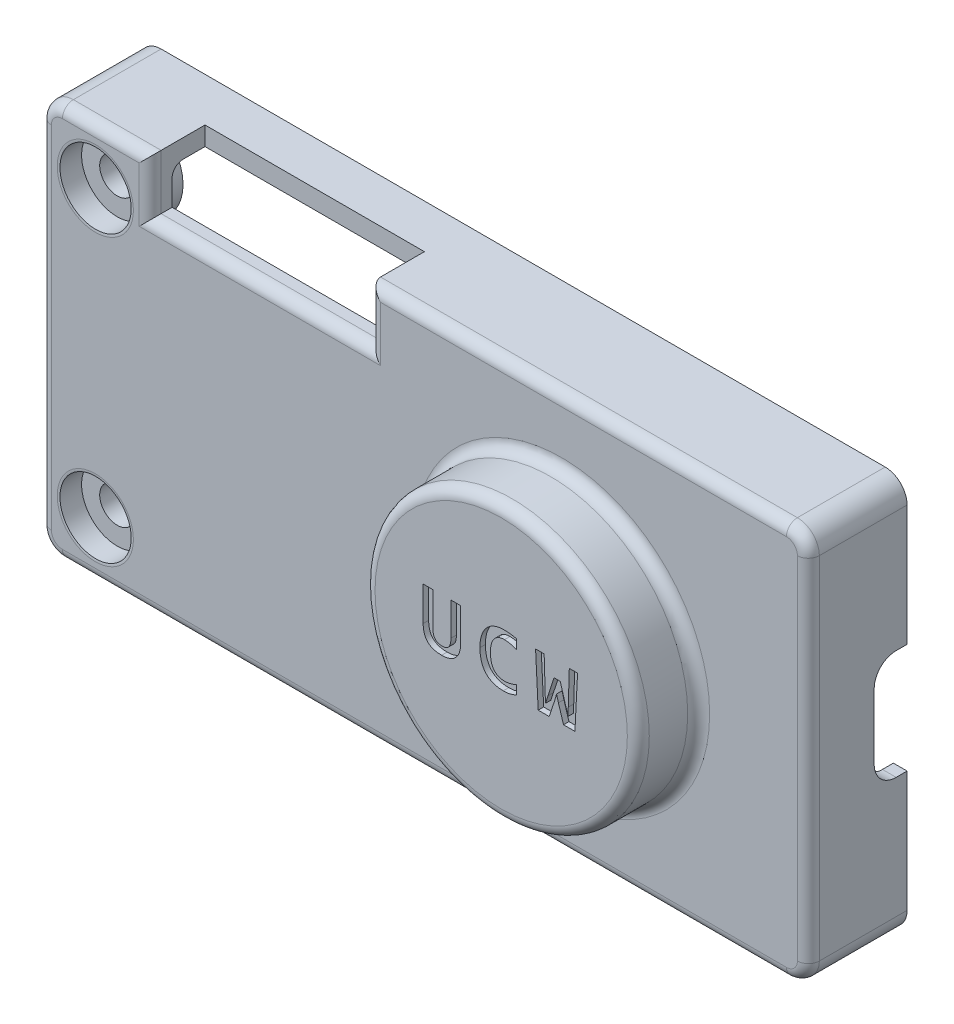
from build123d import *

# Parameters (mm, degrees)
CROQUIS1_W                                  = 70
CROQUIS1_H                                  = 36
SALIENTE_EXTRUIR1_DEPTH                     = 2
CROQUIS2_R                                  = 12.5
SALIENTE_EXTRUIR2_DEPTH                     = 5.5
CROQUIS3_W                                  = 70
CROQUIS3_H                                  = 36
CROQUIS3_W_2                                = 66.5
CROQUIS3_H_2                                = 32.5
SALIENTE_EXTRUIR3_DEPTH                     = 5
CROQUIS4_R                                  = 11
CORTAR_EXTRUIR1_DEPTH                       = 6
SALIENTE_EXTRUIR4_DEPTH                     = 2
CROQUIS14_W                                 = 70
CROQUIS14_H                                 = 36
CROQUIS14_W_2                               = 66.5
CROQUIS14_H_2                               = 32.5
SALIENTE_EXTRUIR5_DEPTH                     = 2
CORTAR_EXTRUIR7_DEPTH                       = 2
CROQUIS11_W                                 = 3
CROQUIS11_H                                 = 10
CORTAR_EXTRUIR4_DEPTH                       = 10
CROQUIS16_W                                 = 20
CROQUIS16_H                                 = 5
CORTAR_EXTRUIR8_DEPTH                       = 5
CORTAR_EXTRUIR9_DEPTH                       = 1.5
REFRENTADO_PARA_TORNILLO_CON_CABEZA_2_COUNT = 2
REFRENTADO_PARA_TORNILLO_CON_CABEZA_2_PITCH = 26
REDONDEO1_R                                 = 1
REDONDEO2_R                                 = 1
REDONDEO3_R                                 = 2
CORTAR_EXTRUIR6_DEPTH                       = 0.5


with BuildPart() as part:
    # Croquis1 → Saliente-Extruir1 (new body)
    with BuildSketch(Plane.XY):
        with Locations((15.33747406, 26.070037414)):
            Rectangle(CROQUIS1_W, CROQUIS1_H)
    extrude(amount=SALIENTE_EXTRUIR1_DEPTH)

    # Croquis2 → Saliente-Extruir2 (add)
    with BuildSketch(Plane.XY.offset(2)):
        with Locations((27.83747406, 25.570037414)):
            Circle(CROQUIS2_R)
    extrude(amount=SALIENTE_EXTRUIR2_DEPTH)

    # Croquis3 → Saliente-Extruir3 (add)
    with BuildSketch(Plane(origin=(0, 0, 0), x_dir=(-1, 0, 0), z_dir=(0, 0, -1))):
        with Locations((-15.33747406, 26.070037414)):
            Rectangle(CROQUIS3_W, CROQUIS3_H)
        with Locations((-15.33747406, 26.113242754)):
            Rectangle(CROQUIS3_W_2, CROQUIS3_H_2, mode=Mode.SUBTRACT)
    extrude(amount=SALIENTE_EXTRUIR3_DEPTH)

    # Croquis4 → Cortar-Extruir1 (cut)
    with BuildSketch(Plane(origin=(0, 0, 0), x_dir=(-1, 0, 0), z_dir=(0, 0, -1))):
        with Locations((-27.83747406, 25.570037414)):
            Circle(CROQUIS4_R)
    extrude(amount=-CORTAR_EXTRUIR1_DEPTH, mode=Mode.SUBTRACT)

    # Croquis5 → Saliente-Extruir4 (add)
    with BuildSketch(Plane(origin=(0, 0, 0), x_dir=(-1, 0, 0), z_dir=(0, 0, -1))):
        with BuildLine():
            Line((-48.58747406, 15.776832074), (-48.58747406, 9.776832074))
            Line((-48.58747406, 9.776832074), (-45.58747406, 9.776832074))
            Line((-45.58747406, 9.776832074), (-42.58747406, 9.776832074))
            ThreePointArc((-42.58747406, 9.776832074), (-42.58747406, 15.776832074), (-48.58747406, 15.776832074))
        make_face()
        with BuildLine():
            Line((-45.58747406, 42.363242754), (-48.58747406, 42.363242754))
            Line((-48.58747406, 42.363242754), (-48.58747406, 36.363242754))
            ThreePointArc((-48.58747406, 36.363242754), (-42.58747406, 36.363242754), (-42.58747406, 42.363242754))
            Line((-42.58747406, 42.363242754), (-45.58747406, 42.363242754))
        make_face()
        with BuildLine():
            Line((14.91252594, 9.776832074), (17.91252594, 9.776832074))
            Line((17.91252594, 9.776832074), (17.91252594, 15.776832074))
            ThreePointArc((17.91252594, 15.776832074), (11.91252594, 15.776832074), (11.91252594, 9.776832074))
            Line((11.91252594, 9.776832074), (14.91252594, 9.776832074))
        make_face()
        with BuildLine():
            Line((17.91252594, 36.363242754), (17.91252594, 42.363242754))
            Line((17.91252594, 42.363242754), (14.91252594, 42.363242754))
            Line((14.91252594, 42.363242754), (11.91252594, 42.363242754))
            ThreePointArc((11.91252594, 42.363242754), (11.91252594, 36.363242754), (17.91252594, 36.363242754))
        make_face()
    extrude(amount=SALIENTE_EXTRUIR4_DEPTH)

    # Croquis14 → Saliente-Extruir5 (add)
    with BuildSketch(Plane(origin=(0, 0, -5), x_dir=(-1, 0, 0), z_dir=(0, 0, -1))):
        with Locations((-15.33747406, 26.070037414)):
            Rectangle(CROQUIS14_W, CROQUIS14_H)
        with Locations((-15.33747406, 26.113242754)):
            Rectangle(CROQUIS14_W_2, CROQUIS14_H_2, mode=Mode.SUBTRACT)
    extrude(amount=SALIENTE_EXTRUIR5_DEPTH)

    # Croquis15 → Cortar-Extruir7 (cut)
    with BuildSketch(Plane.XZ.offset(-8.070037414)):
        Polygon((9.83747406, -3), (9.83747406, -6), (9.83747406, -7), (40.83747406, -7), (40.83747406, -3), align=None)
    extrude(amount=-CORTAR_EXTRUIR7_DEPTH, mode=Mode.SUBTRACT)

    # Croquis11 → Cortar-Extruir4 (cut)
    with BuildSketch(Plane(origin=(50.33747406, 0, 0), x_dir=(0, 0, -1), z_dir=(1, 0, 0))):
        with Locations((5.5, 26.070037414)):
            Rectangle(CROQUIS11_W, CROQUIS11_H)
    extrude(amount=-CORTAR_EXTRUIR4_DEPTH, mode=Mode.SUBTRACT)

    # Croquis16 → Cortar-Extruir8 (cut)
    with BuildSketch(Plane(origin=(0, 44.070037414, 0), x_dir=(1, 0, 0), z_dir=(0, 1, 0))):
        with Locations((0.33747406, 0.5)):
            Rectangle(CROQUIS16_W, CROQUIS16_H)
    extrude(amount=-CORTAR_EXTRUIR8_DEPTH, mode=Mode.SUBTRACT)

    # Croquis17 → Cortar-Extruir9 (cut)
    with BuildSketch(Plane(origin=(0, 0, -7), x_dir=(-1, 0, 0), z_dir=(0, 0, -1))):
        Polygon((-48.58747406, 31.070037414), (-48.58747406, 42.363242754), (-48.58747406, 42.863242754), (-49.08747406, 42.863242754), (-49.08747406, 31.070037414), align=None)
        Polygon((-48.58747406, 9.863242754), (-48.58747406, 31.070037414), (-49.08747406, 31.070037414), (-49.08747406, 9.363242754), (-9.83747406, 9.363242754), (-9.83747406, 9.863242754), align=None)
        Polygon((18.41252594, 9.863242754), (17.91252594, 9.863242754), (-9.83747406, 9.863242754), (-9.83747406, 9.363242754), (18.41252594, 9.363242754), align=None)
        Polygon((-48.58747406, 42.863242754), (-48.58747406, 42.363242754), (17.91252594, 42.363242754), (17.91252594, 9.863242754), (18.41252594, 9.863242754), (18.41252594, 42.863242754), align=None)
    extrude(amount=-CORTAR_EXTRUIR9_DEPTH, mode=Mode.SUBTRACT)

    # Croquis8 → Refrentado para tornillo con cabeza plana de M31 (revolve, cut)
    with BuildSketch(Plane(origin=(-14.66252594, 39.070037414, 2), x_dir=(0, -1, 0), z_dir=(1, 0, 0))):
        Polygon((0, 0), (0, 9), (1.6, 9), (1.6, 2), (3.25, 2), (3.25, 0.025), (3.275, 0), align=None)
    refrentado_para_tornillo_con_cabeza_plan = revolve(axis=Axis((-14.66252594, 39.070037414, 8.35), (0, 0, -1)), mode=Mode.SUBTRACT)

    # Refrentado para tornillo con cabeza  2: Refrentado para tornillo con cabeza plana de M31 ×2
    with Locations(*[(0, -i * REFRENTADO_PARA_TORNILLO_CON_CABEZA_2_PITCH, 0) for i in range(1, REFRENTADO_PARA_TORNILLO_CON_CABEZA_2_COUNT)]):
        add(refrentado_para_tornillo_con_cabeza_plan, mode=Mode.SUBTRACT)

    # Redondeo1
    redondeo1_edges = [part.edges().sort_by_distance(p)[0] for p in [
        (-10.78752594, 42.363242754, 0),
        (38.83747406, 25.570037414, 6),
        (38.83747406, 25.570037414, 0),
        (26.46247406, 42.363242754, 0),
        (42.58747406, 36.363242754, 0),
        (48.58747406, 26.070037414, 0),
        (42.630381187, 15.81913412, 0),
        (-11.91252594, 36.363242754, 0),
        (-17.91252594, 26.070037414, 0),
        (15.33747406, 9.863242754, 0),
        (-11.955433067, 15.81913412, 0),
    ]]
    fillet(redondeo1_edges, radius=REDONDEO1_R)

    # Redondeo2
    # the kernel refuses this fillet: 1 mm, written as the material it adds along each edge
    with BuildSketch(Plane(origin=(27.83747406, 25.570037414, 2), x_dir=(1, 0, 0), z_dir=(0, -1, 0))) as redondeo2_piece_1:
        with BuildLine():
            CenterArc((12.5 + REDONDEO2_R, REDONDEO2_R), REDONDEO2_R, 180, 90)
            Line((12.5, REDONDEO2_R), (12.5, 0))
            Line((12.5, 0), (12.5 + REDONDEO2_R, 0))
        make_face()
    revolve(axis=Axis((27.83747406, 25.570037414, 2), (0, 0, 1)))
    # the kernel refuses this fillet: 1 mm, written as the material it takes off along each edge
    with BuildSketch(Plane(origin=(50.33747406, 46.570037414, 2), x_dir=(-1, 0, 0), z_dir=(0, -1, 0)), Plane(origin=(-19.66252594, 5.570037414, 2), x_dir=(1, 0, 0), z_dir=(0, 1, 0))) as redondeo2_2_piece_1:
        with BuildLine():
            CenterArc((REDONDEO2_R, REDONDEO2_R), REDONDEO2_R, 180, 90)
            Line((0, REDONDEO2_R), (0, 0))
            Line((0, 0), (REDONDEO2_R, 0))
        make_face()
    extrude(amount=41, mode=Mode.SUBTRACT)
    with BuildSketch(Plane(origin=(27.83747406, 25.570037414, 7.5), x_dir=(1, 0, 0), z_dir=(0, -1, 0))) as redondeo2_2_piece_2:
        with BuildLine():
            CenterArc((12.5 - REDONDEO2_R, -REDONDEO2_R), REDONDEO2_R, 0, 90)
            Line((12.5 - REDONDEO2_R, 0), (12.5, 0))
            Line((12.5, 0), (12.5, -REDONDEO2_R))
        make_face()
    revolve(axis=Axis((27.83747406, 25.570037414, 7.5), (0, 0, 1)), mode=Mode.SUBTRACT)
    with BuildSketch(Plane(origin=(-22.16252594, 44.070037414, 2), x_dir=(0, 0, -1), z_dir=(1, 0, 0))) as redondeo2_2_piece_3:
        with BuildLine():
            CenterArc((REDONDEO2_R, -REDONDEO2_R), REDONDEO2_R, 90, 90)
            Line((0, -REDONDEO2_R), (0, 0))
            Line((0, 0), (REDONDEO2_R, 0))
        make_face()
    extrude(amount=15, mode=Mode.SUBTRACT)
    with BuildSketch(Plane(origin=(-9.66252594, 46.570037414, 2), x_dir=(-1, 0, 0), z_dir=(0, -1, 0)), Plane(origin=(10.33747406, 46.570037414, 2), x_dir=(0, 0, -1), z_dir=(0, -1, 0))) as redondeo2_2_piece_4:
        with BuildLine():
            CenterArc((REDONDEO2_R, REDONDEO2_R), REDONDEO2_R, 180, 90)
            Line((0, REDONDEO2_R), (0, 0))
            Line((0, 0), (REDONDEO2_R, 0))
        make_face()
    extrude(amount=7.5, mode=Mode.SUBTRACT)
    with BuildSketch(Plane(origin=(-9.66252594, 39.070037414, 2), x_dir=(0, 0, -1), z_dir=(1, 0, 0))) as redondeo2_2_piece_5:
        with BuildLine():
            CenterArc((REDONDEO2_R, -REDONDEO2_R), REDONDEO2_R, 90, 90)
            Line((0, -REDONDEO2_R), (0, 0))
            Line((0, 0), (REDONDEO2_R, 0))
        make_face()
    extrude(amount=20, mode=Mode.SUBTRACT)
    with BuildSketch(Plane(origin=(7.83747406, 44.070037414, 2), x_dir=(0, 0, -1), z_dir=(1, 0, 0))) as redondeo2_2_piece_6:
        with BuildLine():
            CenterArc((REDONDEO2_R, -REDONDEO2_R), REDONDEO2_R, 90, 90)
            Line((0, -REDONDEO2_R), (0, 0))
            Line((0, 0), (REDONDEO2_R, 0))
        make_face()
    extrude(amount=45, mode=Mode.SUBTRACT)
    with BuildSketch(Plane(origin=(-14.66252594, 13.070037414, 2), x_dir=(0, -1, 0), z_dir=(1, 0, 0))) as redondeo2_2_piece_7:
        with BuildLine():
            CenterArc((3.47220486, 1), REDONDEO2_R, 257.161431859, 12.838568141)
            Line((3.25, 0.025), (3.275, 0))
            Line((3.275, 0), (3.47220486, 0))
        make_face()
    revolve(axis=Axis((-14.66252594, 13.070037414, 2), (0, 0, -1)), mode=Mode.SUBTRACT)
    with BuildSketch(Plane(origin=(-14.66252594, 39.070037414, 2), x_dir=(0, -1, 0), z_dir=(1, 0, 0))) as redondeo2_2_piece_8:
        with BuildLine():
            CenterArc((3.47220486, 1), REDONDEO2_R, 257.161431859, 12.838568141)
            Line((3.25, 0.025), (3.275, 0))
            Line((3.275, 0), (3.47220486, 0))
        make_face()
    revolve(axis=Axis((-14.66252594, 39.070037414, 2), (0, 0, -1)), mode=Mode.SUBTRACT)
    with BuildSketch(Plane(origin=(52.83747406, 8.070037414, 2), x_dir=(0, 1, 0), z_dir=(-1, 0, 0))) as redondeo2_2_piece_9:
        with BuildLine():
            CenterArc((REDONDEO2_R, REDONDEO2_R), REDONDEO2_R, 180, 90)
            Line((0, REDONDEO2_R), (0, 0))
            Line((0, 0), (REDONDEO2_R, 0))
        make_face()
    extrude(amount=75, mode=Mode.SUBTRACT)
    with BuildSketch(Plane(origin=(-12.16252594, 39.070037414, 2), x_dir=(0, 0, -1), z_dir=(1, 0, 0))) as redondeo2_2_piece_10a_section:
        with BuildLine():
            CenterArc((REDONDEO2_R, -REDONDEO2_R), REDONDEO2_R, 90, 90)
            Line((0, -REDONDEO2_R), (0, 0))
            Line((0, 0), (REDONDEO2_R, 0))
        make_face()
    redondeo2_2_piece_10a = extrude(amount=22.5, mode=Mode.PRIVATE)
    redondeo2_2_piece_10a = split(redondeo2_2_piece_10a, bisect_by=Plane(origin=(-9.66252594, 39.070037414, 2), z_dir=(-1, 0, 0)), keep=Keep.TOP, mode=Mode.PRIVATE)
    with BuildSketch(Plane(origin=(-9.66252594, 46.570037414, 2), x_dir=(-1, 0, 0), z_dir=(0, -1, 0))) as redondeo2_2_piece_10b_section:
        with BuildLine():
            CenterArc((REDONDEO2_R, REDONDEO2_R), REDONDEO2_R, 180, 90)
            Line((0, REDONDEO2_R), (0, 0))
            Line((0, 0), (REDONDEO2_R, 0))
        make_face()
    redondeo2_2_piece_10b = extrude(amount=10, mode=Mode.PRIVATE)
    redondeo2_2_piece_10b = split(redondeo2_2_piece_10b, bisect_by=Plane(origin=(-9.66252594, 39.070037414, 2), z_dir=(0, -1, 0)), keep=Keep.TOP, mode=Mode.PRIVATE)
    redondeo2_2_piece_10 = redondeo2_2_piece_10a & redondeo2_2_piece_10b
    add(redondeo2_2_piece_10, mode=Mode.SUBTRACT)
    with BuildSketch(Plane(origin=(10.33747406, 46.570037414, 2), x_dir=(0, 0, -1), z_dir=(0, -1, 0))) as redondeo2_2_piece_11a_section:
        with BuildLine():
            CenterArc((REDONDEO2_R, REDONDEO2_R), REDONDEO2_R, 180, 90)
            Line((0, REDONDEO2_R), (0, 0))
            Line((0, 0), (REDONDEO2_R, 0))
        make_face()
    redondeo2_2_piece_11a = extrude(amount=10, mode=Mode.PRIVATE)
    redondeo2_2_piece_11a = split(redondeo2_2_piece_11a, bisect_by=Plane(origin=(10.33747406, 39.070037414, 2), z_dir=(0, -1, 0)), keep=Keep.TOP, mode=Mode.PRIVATE)
    with BuildSketch(Plane(origin=(-9.66252594, 39.070037414, 2), x_dir=(0, 0, -1), z_dir=(1, 0, 0))) as redondeo2_2_piece_11b_section:
        with BuildLine():
            CenterArc((REDONDEO2_R, -REDONDEO2_R), REDONDEO2_R, 90, 90)
            Line((0, -REDONDEO2_R), (0, 0))
            Line((0, 0), (REDONDEO2_R, 0))
        make_face()
    redondeo2_2_piece_11b = extrude(amount=22.5, mode=Mode.PRIVATE)
    redondeo2_2_piece_11b = split(redondeo2_2_piece_11b, bisect_by=Plane(origin=(10.33747406, 39.070037414, 2), z_dir=(1, 0, 0)), keep=Keep.TOP, mode=Mode.PRIVATE)
    redondeo2_2_piece_11 = redondeo2_2_piece_11a & redondeo2_2_piece_11b
    add(redondeo2_2_piece_11, mode=Mode.SUBTRACT)

    # Redondeo3
    # the kernel refuses this fillet: 2 mm, written as the material it adds along each edge
    with BuildSketch(Plane(origin=(48.58747406, 9.863242754, -5.5), x_dir=(-1, 0, 0), z_dir=(0, 0, 1)), Plane(origin=(-17.91252594, 9.863242754, -2), x_dir=(1, 0, 0), z_dir=(0, 0, -1)), Plane(origin=(-17.91252594, 42.363242754, -5.5), x_dir=(1, 0, 0), z_dir=(0, 0, 1))) as redondeo3_piece_1:
        with BuildLine():
            CenterArc((REDONDEO3_R, -REDONDEO3_R), REDONDEO3_R, 90, 90)
            Line((0, -REDONDEO3_R), (0, 0))
            Line((0, 0), (REDONDEO3_R, 0))
        make_face()
    extrude(amount=3.5)
    with BuildSketch(Plane(origin=(50.33747406, 21.070037414, -4), x_dir=(0, 1, 0), z_dir=(-1, 0, 0))) as redondeo3_piece_2_section:
        with BuildLine():
            CenterArc((REDONDEO3_R, REDONDEO3_R), REDONDEO3_R, 180, 90)
            Line((0, REDONDEO3_R), (0, 0))
            Line((0, 0), (REDONDEO3_R, 0))
        make_face()
    redondeo3_piece_2 = extrude(amount=1.75, mode=Mode.PRIVATE)
    redondeo3_piece_2 = split(redondeo3_piece_2, bisect_by=Plane(origin=(50.33747406, 21.070037414, -5.5), z_dir=(0, 0, 1)), keep=Keep.TOP, mode=Mode.PRIVATE)
    add(redondeo3_piece_2)
    with BuildSketch(Plane(origin=(50.33747406, 21.070037414, -4), x_dir=(0, 1, 0), z_dir=(-1, 0, 0))) as redondeo3_piece_3_section:
        with BuildLine():
            CenterArc((REDONDEO3_R, REDONDEO3_R), REDONDEO3_R, 180, 90)
            Line((0, REDONDEO3_R), (0, 0))
            Line((0, 0), (REDONDEO3_R, 0))
        make_face()
    redondeo3_piece_3 = extrude(amount=6.75, mode=Mode.PRIVATE)
    redondeo3_piece_3 = split(redondeo3_piece_3, bisect_by=Plane(origin=(49.08747406, 21.070037414, -4), z_dir=(1, 0, 0)), keep=Keep.TOP, mode=Mode.PRIVATE)
    add(redondeo3_piece_3)
    with BuildSketch(Plane(origin=(50.33747406, 31.070037414, -4), x_dir=(0, -1, 0), z_dir=(-1, 0, 0))) as redondeo3_piece_4_section:
        with BuildLine():
            CenterArc((REDONDEO3_R, -REDONDEO3_R), REDONDEO3_R, 90, 90)
            Line((0, -REDONDEO3_R), (0, 0))
            Line((0, 0), (REDONDEO3_R, 0))
        make_face()
    redondeo3_piece_4 = extrude(amount=1.75, mode=Mode.PRIVATE)
    redondeo3_piece_4 = split(redondeo3_piece_4, bisect_by=Plane(origin=(50.33747406, 31.070037414, -5.5), z_dir=(0, 0, 1)), keep=Keep.TOP, mode=Mode.PRIVATE)
    add(redondeo3_piece_4)
    with BuildSketch(Plane(origin=(50.33747406, 31.070037414, -4), x_dir=(0, -1, 0), z_dir=(-1, 0, 0))) as redondeo3_piece_5_section:
        with BuildLine():
            CenterArc((REDONDEO3_R, -REDONDEO3_R), REDONDEO3_R, 90, 90)
            Line((0, -REDONDEO3_R), (0, 0))
            Line((0, 0), (REDONDEO3_R, 0))
        make_face()
    redondeo3_piece_5 = extrude(amount=6.75, mode=Mode.PRIVATE)
    redondeo3_piece_5 = split(redondeo3_piece_5, bisect_by=Plane(origin=(49.08747406, 31.070037414, -4), z_dir=(1, 0, 0)), keep=Keep.TOP, mode=Mode.PRIVATE)
    add(redondeo3_piece_5)
    with BuildSketch(Plane(origin=(48.58747406, 42.363242754, -5.5), x_dir=(-1, 0, 0), z_dir=(0, 0, 1))) as redondeo3_piece_6:
        with BuildLine():
            CenterArc((REDONDEO3_R, REDONDEO3_R), REDONDEO3_R, 180, 90)
            Line((0, REDONDEO3_R), (0, 0))
            Line((0, 0), (REDONDEO3_R, 0))
        make_face()
    extrude(amount=3.5)
    with BuildSketch(Plane(origin=(49.08747406, 9.363242754, -7), x_dir=(0, 1, 0), z_dir=(0, 0, 1))) as redondeo3_piece_7:
        with BuildLine():
            CenterArc((REDONDEO3_R, REDONDEO3_R), REDONDEO3_R, 180, 90)
            Line((0, REDONDEO3_R), (0, 0))
            Line((0, 0), (REDONDEO3_R, 0))
        make_face()
    extrude(amount=6.5)
    with BuildSketch(Plane(origin=(-18.41252594, 9.363242754, -7), x_dir=(0, 1, 0), z_dir=(0, 0, 1)), Plane(origin=(-18.41252594, 42.863242754, -7), x_dir=(1, 0, 0), z_dir=(0, 0, 1)), Plane(origin=(49.08747406, 42.863242754, -7), x_dir=(0, -1, 0), z_dir=(0, 0, 1))) as redondeo3_piece_8:
        with BuildLine():
            CenterArc((REDONDEO3_R, -REDONDEO3_R), REDONDEO3_R, 90, 90)
            Line((0, -REDONDEO3_R), (0, 0))
            Line((0, 0), (REDONDEO3_R, 0))
        make_face()
    extrude(amount=6.5)
    # the kernel refuses this fillet: 2 mm, written as the material it takes off along each edge
    with BuildSketch(Plane(origin=(48.33747406, 10.070037414, 2), x_dir=(0, -1, 0), z_dir=(-1, 0, 0))) as redondeo3_2_piece_1:
        with BuildLine():
            CenterArc((1, -1), 1, 0, 90)
            Line((2, -1), (2, 0))
            Line((2, 0), (1, 0))
        make_face()
    revolve(axis=Axis((48.33747406, 10.070037414, 2), (0, 0, 1)), revolution_arc=90, mode=Mode.SUBTRACT)
    with BuildSketch(Plane(origin=(-17.66252594, 10.070037414, 2), x_dir=(-1, 0, 0), z_dir=(0, 1, 0))) as redondeo3_2_piece_2:
        with BuildLine():
            CenterArc((1, -1), 1, 0, 90)
            Line((2, -1), (2, 0))
            Line((2, 0), (1, 0))
        make_face()
    revolve(axis=Axis((-17.66252594, 10.070037414, 2), (0, 0, 1)), revolution_arc=90, mode=Mode.SUBTRACT)
    with BuildSketch(Plane(origin=(48.33747406, 42.070037414, 2), x_dir=(1, 0, 0), z_dir=(0, -1, 0))) as redondeo3_2_piece_3:
        with BuildLine():
            CenterArc((1, -1), 1, 0, 90)
            Line((2, -1), (2, 0))
            Line((2, 0), (1, 0))
        make_face()
    revolve(axis=Axis((48.33747406, 42.070037414, 2), (0, 0, 1)), revolution_arc=90, mode=Mode.SUBTRACT)
    with BuildSketch(Plane(origin=(-17.66252594, 42.070037414, 2), x_dir=(0, 1, 0), z_dir=(1, 0, 0))) as redondeo3_2_piece_4:
        with BuildLine():
            CenterArc((1, -1), 1, 0, 90)
            Line((2, -1), (2, 0))
            Line((2, 0), (1, 0))
        make_face()
    revolve(axis=Axis((-17.66252594, 42.070037414, 2), (0, 0, 1)), revolution_arc=90, mode=Mode.SUBTRACT)
    with BuildSketch(Plane(origin=(50.33747406, 44.070037414, 2), x_dir=(-1, 0, 0), z_dir=(0, 0, -1))) as redondeo3_2_piece_5:
        with BuildLine():
            CenterArc((REDONDEO3_R, -REDONDEO3_R), REDONDEO3_R, 90, 90)
            Line((0, -REDONDEO3_R), (0, 0))
            Line((0, 0), (REDONDEO3_R, 0))
        make_face()
    extrude(amount=14, mode=Mode.SUBTRACT)
    with BuildSketch(Plane(origin=(-19.66252594, 44.070037414, -12), x_dir=(0, -1, 0), z_dir=(0, 0, 1)), Plane(origin=(-19.66252594, 8.070037414, -12), x_dir=(1, 0, 0), z_dir=(0, 0, 1)), Plane(origin=(50.33747406, 8.070037414, 2), x_dir=(-1, 0, 0), z_dir=(0, 0, -1))) as redondeo3_2_piece_6:
        with BuildLine():
            CenterArc((REDONDEO3_R, REDONDEO3_R), REDONDEO3_R, 180, 90)
            Line((0, REDONDEO3_R), (0, 0))
            Line((0, 0), (REDONDEO3_R, 0))
        make_face()
    extrude(amount=14, mode=Mode.SUBTRACT)

    # Croquis13 → Cortar-Extruir6 (cut)
    with BuildSketch(Plane.XY.offset(7.5)):
        with BuildLine():
            add(Edge.make_bspline(
                [(24.142745535, 25.305330145), (24.141372061, 25.232655617), (24.13870565, 25.09156801), (24.116339379, 24.886383471), (24.077790148, 24.695005223), (24.026106104, 24.517019026), (23.959376953, 24.353734768), (23.880508947, 24.203877078), (23.786895331, 24.068737645), (23.681080565, 23.946923954), (23.560961106, 23.841065109), (23.430444883, 23.746849913), (23.285551565, 23.669239838), (23.129833472, 23.603790229), (22.962419235, 23.55422377), (22.785643149, 23.517739536), (22.598685239, 23.496301169), (22.470774243, 23.493444387), (22.405218882, 23.491980264)],
                knots=[0, 0, 0, 0, 1.219997119, 2.368456715, 3.459737151, 4.494217563, 5.475369761, 6.416549746, 7.331712276, 8.229634853, 9.11860117, 10.014193365, 10.926227794, 11.871951459, 12.84573959, 13.852641022, 14.899462143, 16, 16, 16, 16], degree=3))
            add(Edge.make_bspline(
                [(22.405218882, 23.491980264), (22.332548545, 23.493417758), (22.19221519, 23.496193695), (21.989588891, 23.5173189), (21.803034704, 23.553422123), (21.632137487, 23.603148473), (21.477219851, 23.667594248), (21.337642987, 23.744322148), (21.213230113, 23.834000744), (21.103536956, 23.935401635), (21.009772526, 24.050700614), (20.929385392, 24.176658355), (20.864179878, 24.315146824), (20.811955461, 24.464089301), (20.772729402, 24.624063587), (20.745810903, 24.793776158), (20.727902932, 24.97282079), (20.726221583, 25.095257942), (20.7253606, 25.15795542)],
                knots=[0, 0, 0, 0, 1.281917861, 2.475505707, 3.58892954, 4.63019599, 5.609909515, 6.543192557, 7.433876716, 8.309262984, 9.170477168, 10.048562614, 10.939047482, 11.86464975, 12.828821265, 13.840637757, 14.894236228, 16, 16, 16, 16], degree=3))
            Line((20.7253606, 25.15795542), (20.7253606, 28.276319174))
            Line((20.7253606, 28.276319174), (21.613880683, 28.276319174))
            Line((21.613880683, 28.276319174), (21.613880683, 25.227371051))
            add(Edge.make_bspline(
                [(21.613880683, 25.227371051), (21.614020315, 25.18925461), (21.614292137, 25.115052713), (21.62418246, 25.007234157), (21.634601978, 24.905358344), (21.652854628, 24.810362869), (21.676926441, 24.722128348), (21.709266835, 24.641210285), (21.748942276, 24.567007901), (21.795892409, 24.499278868), (21.850393578, 24.439624301), (21.911417987, 24.387332241), (21.978387275, 24.342759201), (22.052635853, 24.305151503), (22.135622317, 24.278230184), (22.227420993, 24.257511711), (22.329123709, 24.246349344), (22.40021082, 24.24467665), (22.437256866, 24.24380495)],
                knots=[0, 0, 0, 0, 1.236333264, 2.406790096, 3.511610083, 4.558371009, 5.542234313, 6.475415946, 7.379910926, 8.267651102, 9.142671847, 9.994742041, 10.869457687, 11.74775154, 12.686636398, 13.692831834, 14.797651822, 16, 16, 16, 16], degree=3))
            add(Edge.make_bspline(
                [(22.437256866, 24.24380495), (22.472178769, 24.244253182), (22.53935406, 24.245115394), (22.635708616, 24.256285861), (22.723923756, 24.272566512), (22.804015997, 24.297661821), (22.877485244, 24.32907734), (22.943058845, 24.370969406), (23.004122298, 24.418510927), (23.05629359, 24.477736806), (23.103669584, 24.544047789), (23.14446457, 24.619753463), (23.178157298, 24.704112745), (23.205773685, 24.797136437), (23.228790452, 24.899034596), (23.242504931, 25.011716159), (23.252678489, 25.134275191), (23.253697475, 25.219514785), (23.254225452, 25.263680766)],
                knots=[0, 0, 0, 0, 1.109467361, 2.134156151, 3.079549996, 3.956432823, 4.79746361, 5.610706401, 6.423634226, 7.248756648, 8.109054777, 9.010349122, 9.974850536, 10.991510299, 12.092462108, 13.291135431, 14.596430865, 16, 16, 16, 16], degree=3))
            Line((23.254225452, 25.263680766), (23.254225452, 28.276319174))
            Line((23.254225452, 28.276319174), (24.142745535, 28.276319174))
            Line((24.142745535, 28.276319174), (24.142745535, 25.305330145))
        make_face()
        with BuildLine():
            add(Edge.make_bspline(
                [(29.248318629, 23.765371059), (29.196202338, 23.74312329), (29.093951776, 23.699473851), (28.939400248, 23.644131202), (28.787669505, 23.59684258), (28.637310889, 23.558157196), (28.486671668, 23.527345564), (28.333833241, 23.508077469), (28.178146622, 23.494239332), (28.073268441, 23.492739326), (28.020195918, 23.491980264)],
                knots=[0, 0, 0, 0, 1.072602722, 2.104413604, 3.106297595, 4.08050826, 5.042709706, 6.014913564, 6.995467464, 8, 8, 8, 8], degree=3))
            add(Edge.make_bspline(
                [(28.020195918, 23.491980264), (27.937173187, 23.493797376), (27.775980321, 23.497325391), (27.541110468, 23.525473457), (27.321175319, 23.57197567), (27.115395889, 23.636894193), (26.925297067, 23.721717659), (26.749975564, 23.824697443), (26.589761918, 23.945856574), (26.445766957, 24.0858524), (26.317738004, 24.24371087), (26.207764887, 24.42085405), (26.112413436, 24.614531206), (26.034506212, 24.826479911), (25.973883931, 25.056076838), (25.930929318, 25.303317691), (25.9034684, 25.568134879), (25.900705567, 25.750586687), (25.899281392, 25.844636205)],
                knots=[0, 0, 0, 0, 1.102605573, 2.140764961, 3.136846793, 4.08496906, 5.001529512, 5.896051515, 6.780328523, 7.66316301, 8.557497515, 9.473264751, 10.427030373, 11.420482266, 12.467702166, 13.577100782, 14.751053738, 16, 16, 16, 16], degree=3))
            add(Edge.make_bspline(
                [(25.899281392, 25.844636205), (25.900990057, 25.941189117), (25.90432087, 26.129406033), (25.934102106, 26.40312558), (25.979722834, 26.661093992), (26.047707869, 26.901598105), (26.131334042, 27.125821299), (26.233438458, 27.331406269), (26.349727287, 27.520239395), (26.484129075, 27.689749691), (26.634004104, 27.841202896), (26.799949558, 27.973207239), (26.979941321, 28.087382188), (27.176014378, 28.180336798), (27.385484618, 28.253702545), (27.60784222, 28.307612505), (27.843113841, 28.338507311), (28.004086851, 28.342582724), (28.086407751, 28.344666872)],
                knots=[0, 0, 0, 0, 1.232307787, 2.402218284, 3.511138658, 4.573037126, 5.588482404, 6.562047137, 7.499038646, 8.414657469, 9.317692522, 10.213424542, 11.116219401, 12.033010505, 12.977368732, 13.94518829, 14.949178196, 16, 16, 16, 16], degree=3))
            add(Edge.make_bspline(
                [(28.086407751, 28.344666872), (28.139101952, 28.344714657), (28.241316854, 28.34480735), (28.390792529, 28.338270931), (28.534160794, 28.332459193), (28.674313908, 28.317096948), (28.814221519, 28.300202943), (28.955539483, 28.273791911), (29.101178468, 28.246721296), (29.198622831, 28.221059018), (29.248318629, 28.207971475)],
                knots=[0, 0, 0, 0, 1.077376558, 2.089868288, 3.059369192, 4.010411707, 4.972009834, 5.940198088, 6.949518525, 8, 8, 8, 8], degree=3))
            Line((29.248318629, 28.207971475), (29.248318629, 27.319451392))
            add(Edge.make_bspline(
                [(29.248318629, 27.319451392), (29.197313323, 27.342840698), (29.09743734, 27.388640442), (28.946258345, 27.44572207), (28.799511365, 27.494792062), (28.655991973, 27.53024105), (28.518504059, 27.558483193), (28.386535975, 27.577539069), (28.26107149, 27.589928439), (28.179343976, 27.591892148), (28.139804391, 27.592842186)],
                knots=[0, 0, 0, 0, 1.170030163, 2.291093263, 3.368831198, 4.395296508, 5.372370687, 6.295361994, 7.175300008, 8, 8, 8, 8], degree=3))
            add(Edge.make_bspline(
                [(28.139804391, 27.592842186), (28.084904857, 27.591501293), (27.978885888, 27.588911833), (27.825772232, 27.566387588), (27.685055925, 27.528283105), (27.556907418, 27.474307511), (27.440265153, 27.407219169), (27.333797284, 27.328330765), (27.239408041, 27.235352584), (27.155849675, 27.131217433), (27.082792961, 27.015709875), (27.020098193, 26.889676715), (26.967446916, 26.753118206), (26.926583426, 26.606667344), (26.894524976, 26.451785534), (26.872757239, 26.289027342), (26.858159983, 26.119006048), (26.85682833, 26.003078223), (26.856149174, 25.943953955)],
                knots=[0, 0, 0, 0, 1.109729706, 2.143049175, 3.121026665, 4.050204485, 4.946654748, 5.836403406, 6.722153568, 7.618170183, 8.530804457, 9.480502004, 10.460411604, 11.48580219, 12.551706219, 13.656287425, 14.804684813, 16, 16, 16, 16], degree=3))
            add(Edge.make_bspline(
                [(26.856149174, 25.943953955), (26.856684413, 25.881615516), (26.857729033, 25.759950184), (26.874088992, 25.58293507), (26.895072112, 25.415334759), (26.928398757, 25.258696678), (26.970398136, 25.112546335), (27.024399909, 24.978398528), (27.08691164, 24.854693076), (27.16112342, 24.742913324), (27.245623246, 24.64237308), (27.342483141, 24.555816064), (27.449636429, 24.481132363), (27.567701837, 24.418704328), (27.697797384, 24.370801186), (27.839067847, 24.337203338), (27.991366542, 24.314893871), (28.097002817, 24.313086134), (28.151551651, 24.312152648)],
                knots=[0, 0, 0, 0, 1.256876421, 2.453033611, 3.583260076, 4.661975506, 5.679853963, 6.646528144, 7.574590913, 8.470745685, 9.346915849, 10.216322401, 11.082788599, 11.975686973, 12.902638023, 13.870910894, 14.900573425, 16, 16, 16, 16], degree=3))
            add(Edge.make_bspline(
                [(28.151551651, 24.312152648), (28.193611325, 24.313178172), (28.281255541, 24.315315165), (28.416343525, 24.333905486), (28.556912058, 24.360426307), (28.700635732, 24.393444491), (28.843860305, 24.433850204), (28.984765859, 24.480710749), (29.119730018, 24.531092678), (29.206432115, 24.567806625), (29.248318629, 24.585543443)],
                knots=[0, 0, 0, 0, 0.887372101, 1.849111607, 2.873273884, 3.906654629, 4.960374994, 6.012916101, 7.040022999, 8, 8, 8, 8], degree=3))
            Line((29.248318629, 24.585543443), (29.248318629, 23.765371059))
        make_face()
        Polygon((34.558934819, 23.560327963), (33.516632413, 23.560327963), (33.053149582, 25.062909401), (32.8844162, 25.674834891), (32.707139357, 25.047958342), (32.208414743, 23.560327963), (31.209897582, 23.560327963), (30.970680637, 28.276319174), (31.753475373, 28.276319174), (31.845317593, 25.253001438), (31.868812115, 24.426421457), (32.098417665, 25.137664697), (32.658014448, 26.841017501), (33.216543299, 26.841017501), (33.762256956, 25.010580695), (33.938465866, 24.433896987), (33.950213127, 25.169702681), (34.045259146, 28.276319174), (34.798151764, 28.276319174), align=None)
    extrude(amount=-CORTAR_EXTRUIR6_DEPTH, mode=Mode.SUBTRACT)


solid = part.part
